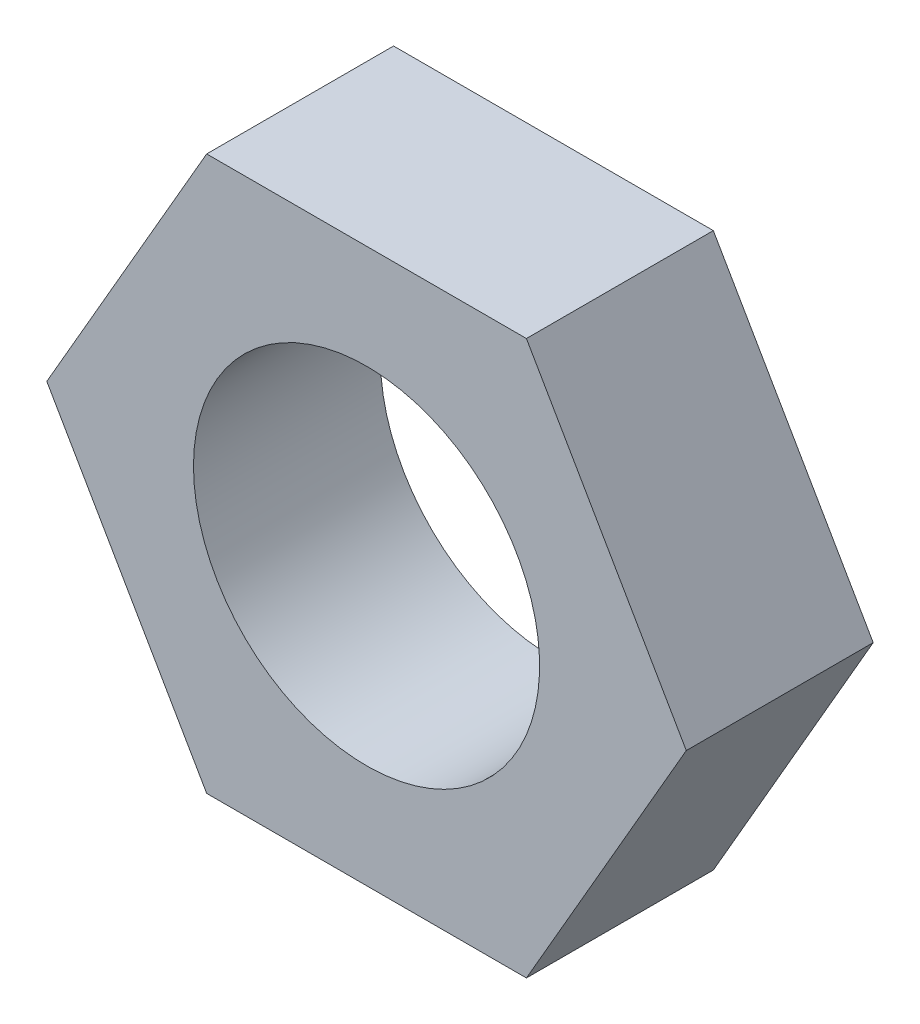
from build123d import *

# Parameters (mm, degrees)
SKETCH1_R           = 2.5
BOSS_EXTRUDE1_DEPTH = 2.7


with BuildPart() as part:
    # Sketch1 → Boss-Extrude1 (new body)
    with BuildSketch(Plane.XY.offset(2.7)):
        Polygon((-2.309401077, 4), (-4.618802154, 0), (-2.309401077, -4), (2.309401077, -4), (4.618802154, 0), (2.309401077, 4), align=None)
        Circle(SKETCH1_R, mode=Mode.SUBTRACT)
    extrude(amount=-BOSS_EXTRUDE1_DEPTH)


solid = part.part
